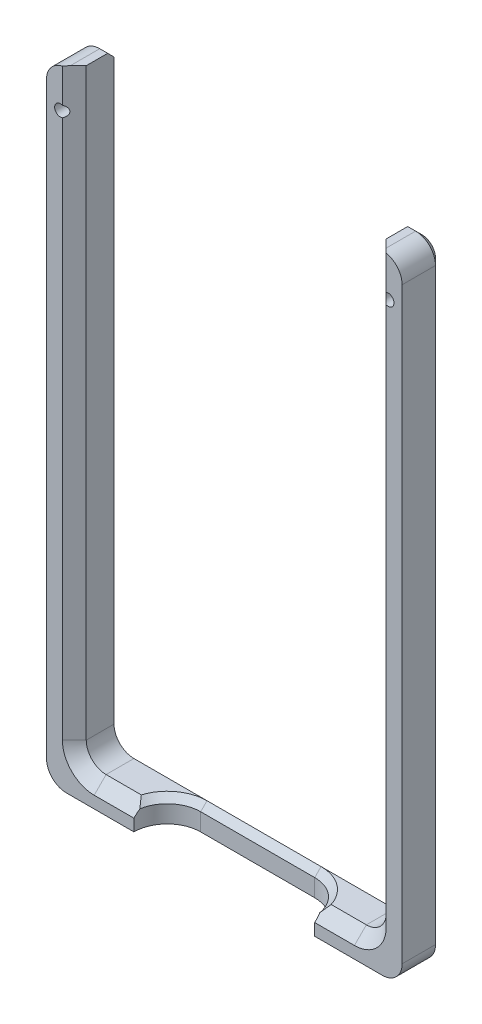
from build123d import *

# Parameters (mm, degrees)
BOSS_EXTRUDE1_DEPTH = 10
SKETCH4_R           = 1.45
CUT_EXTRUDE2_DEPTH  = 93.209340633
FILLET3_R           = 5
CHAMFER1_SIZE       = 3
FILLET1_R           = 5
FILLET2_R           = 5
CHAMFER2_SIZE       = 1.6
CUT_EXTRUDE1_DEPTH  = 165.519185811
CHAMFER3_SIZE       = 1.6


# Some blends are built 0.0001 mm under size
with BuildPart() as part:
    # Sketch2 → Boss-Extrude1 (new body)
    with BuildSketch(Plane.XY):
        Polygon((-44.75, 78), (-37.75, 78), (-37.75, -74), (37.75, -74), (37.75, 78), (44.75, 78), (44.75, -80), (-44.75, -80), align=None)
    extrude(amount=BOSS_EXTRUDE1_DEPTH)

    # Sketch4 → Cut-Extrude2 (cut, through all)
    with BuildSketch(Plane.XY.offset(10)):
        with Locations((-41.25, 68)):
            Circle(SKETCH4_R)
        with Locations(Location((41.25, 68, 0), (0, 0, 180))):
            Circle(SKETCH4_R)
    extrude(amount=-CUT_EXTRUDE2_DEPTH, mode=Mode.SUBTRACT)

    # Fillet3
    fillet3_edges = [part.edges().sort_by_distance(p)[0] for p in [
        (-37.75, -74, 5),
        (37.75, -74, 5),
    ]]
    fillet(fillet3_edges, radius=FILLET3_R)

    # Chamfer1
    # the kernel refuses this chamfer: 3 mm, written as the material it takes off along each edge
    with BuildSketch(Plane(origin=(37.75, -69, 10), x_dir=(0.9996219169112968, 0, 0.02749587661058619), z_dir=(0, 1, 0))) as chamfer1_piece_1:
        Polygon((CHAMFER1_SIZE * 0.999621916911, CHAMFER1_SIZE * 0.0274958766106), (-CHAMFER1_SIZE * 0.0274958766106, CHAMFER1_SIZE * 0.999621916911), (0, 0), align=None)
    extrude(amount=154.715048964, mode=Mode.SUBTRACT)
    with BuildSketch(Plane(origin=(-32.75, -74, 10), x_dir=(0, -0.9996219169112968, 0.02749587661058619), z_dir=(1, 0, 0))) as chamfer1_piece_2:
        Polygon((CHAMFER1_SIZE * 0.999621916911, CHAMFER1_SIZE * 0.0274958766106), (-CHAMFER1_SIZE * 0.0274958766106, CHAMFER1_SIZE * 0.999621916911), (0, 0), align=None)
    extrude(amount=65.5, mode=Mode.SUBTRACT)
    with BuildSketch(Plane(origin=(-37.75, 85.715048964, 10), x_dir=(0.027495876610586775, 0, -0.9996219169112968), z_dir=(0, -1, 0))) as chamfer1_piece_3:
        Polygon((CHAMFER1_SIZE * 0.999621916911, -CHAMFER1_SIZE * 0.0274958766106), (-CHAMFER1_SIZE * 0.0274958766106, -CHAMFER1_SIZE * 0.999621916911), (0, 0), align=None)
    extrude(amount=154.715048964, mode=Mode.SUBTRACT)
    with BuildSketch(Plane(origin=(32.75, -69, 10), x_dir=(0, -1, 0), z_dir=(-1, 0, 0))) as chamfer1_piece_4:
        Polygon((5 + CHAMFER1_SIZE, 0), (5, -CHAMFER1_SIZE), (5, 0), align=None)
    revolve(axis=Axis((32.75, -69, 10), (0, 0, 1)), revolution_arc=90, mode=Mode.SUBTRACT)
    with BuildSketch(Plane(origin=(-32.75, -69, 10), x_dir=(-1, 0, 0), z_dir=(0, 1, 0))) as chamfer1_piece_5:
        Polygon((5, -CHAMFER1_SIZE), (5 + CHAMFER1_SIZE, 0), (5, 0), align=None)
    revolve(axis=Axis((-32.75, -69, 10), (0, 0, 1)), revolution_arc=90, mode=Mode.SUBTRACT)

    # Fillet1
    fillet1_edges = [part.edges().sort_by_distance(p)[0] for p in [
        (44.75, 78, 5),
        (-44.75, 78, 5),
    ]]
    fillet(fillet1_edges, radius=FILLET1_R)

    # Fillet2
    fillet2_edges = [part.edges().sort_by_distance(p)[0] for p in [
        (44.75, -80, 5),
        (-44.75, -80, 5),
    ]]
    fillet(fillet2_edges, radius=FILLET2_R)

    # Chamfer2
    chamfer2_edges = [part.edges().sort_by_distance(p)[0] for p in [
        (38.75, 78, 0),
        (-44.75, -1, 0),
        (-43.285533906, 76.535533906, 0),
        (43.285533906, 76.535533906, 0),
        (-38.75, 78, 0),
        (44.75, -1, 0),
        (0, -80, 0),
        (-43.285533906, -78.535533906, 0),
        (43.285533906, -78.535533906, 0),
    ]]
    chamfer(chamfer2_edges, length=CHAMFER2_SIZE)

    # Sketch3 → Cut-Extrude1 (cut, through all)
    with BuildSketch(Plane.XZ.offset(80)):
        with BuildLine():
            Line((-14.35, 18.4), (14.35, 18.4))
            ThreePointArc((14.35, 18.4), (22.75, 10), (14.35, 1.6))
            Line((14.35, 1.6), (-14.35, 1.6))
            ThreePointArc((-14.35, 1.6), (-22.75, 10), (-14.35, 18.4))
        make_face()
    extrude(amount=-CUT_EXTRUDE1_DEPTH, mode=Mode.SUBTRACT)

    # Chamfer3
    chamfer3_edges = [part.edges().sort_by_distance(p)[0] for p in [
        (-19.11235236, -74, 3.080462443),
        (19.11235236, -74, 3.080462443),
        (0, -74, 1.6),
    ]]
    chamfer(chamfer3_edges, length=CHAMFER3_SIZE - 0.0001)  # a hair under: the kernel refuses the full size


solid = part.part
